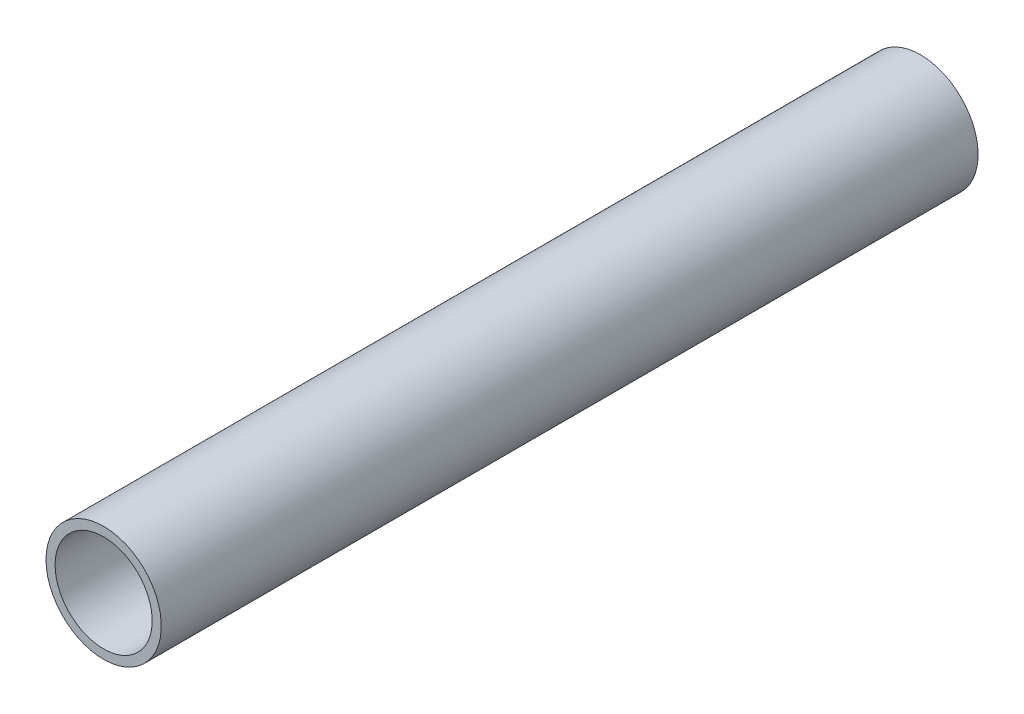
from build123d import *

# Parameters (mm, degrees)
SKETCH1_R           = 12.7
SKETCH1_R_2         = 10.7
BOSS_EXTRUDE1_DEPTH = 180


with BuildPart() as part:
    # Sketch1 → Boss-Extrude1 (new body)
    with BuildSketch(Plane.XY):
        Circle(SKETCH1_R)
        Circle(SKETCH1_R_2, mode=Mode.SUBTRACT)
    extrude(amount=BOSS_EXTRUDE1_DEPTH)


solid = part.part
